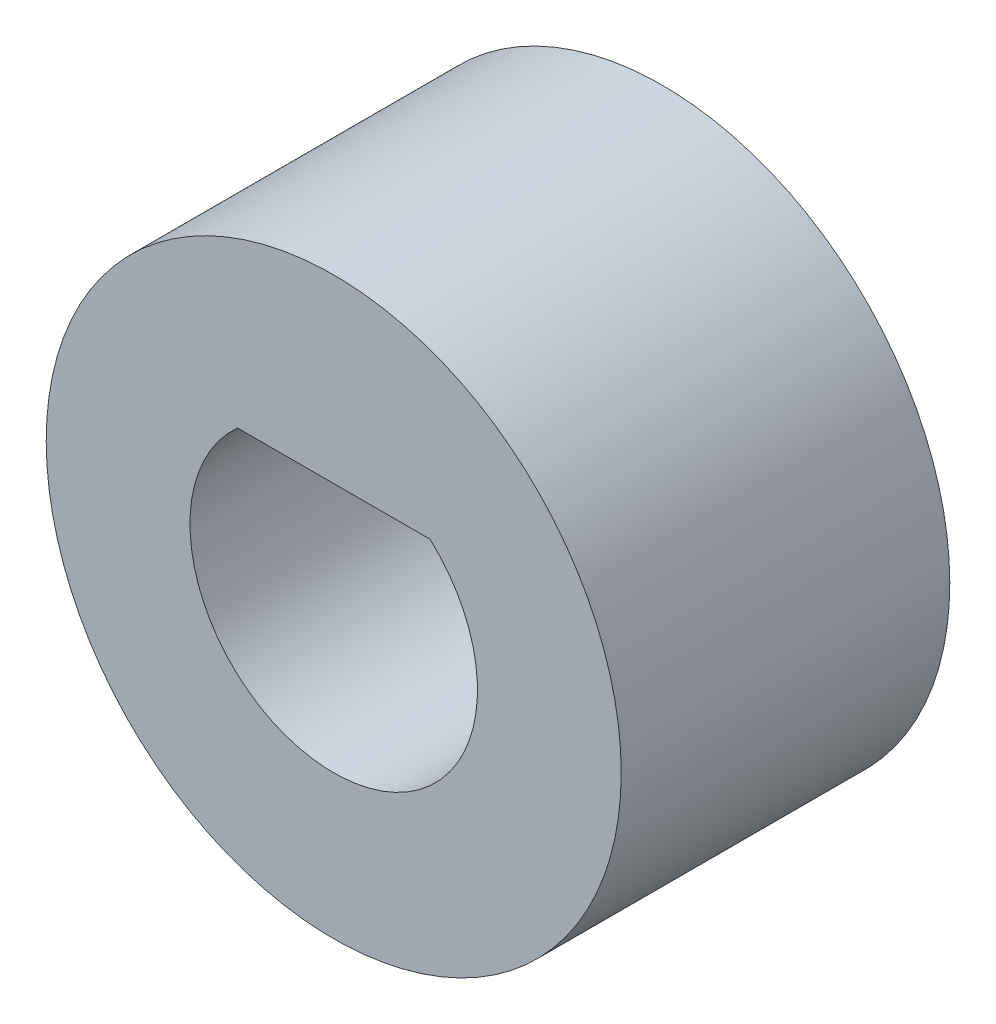
from build123d import *

# Parameters (mm, degrees)
ESQUISSE1_R        = 7
BOSS_EXTRU_1_DEPTH = 8


with BuildPart() as part:
    # Esquisse1 → Boss.-Extru.1 (new body)
    with BuildSketch(Plane.XY):
        Circle(ESQUISSE1_R)
        with BuildLine():
            Line((-2.343074903, 2.6), (2.343074903, 2.6))
            ThreePointArc((2.343074903, 2.6), (0, -3.5), (-2.343074903, 2.6))
        make_face(mode=Mode.SUBTRACT)
    extrude(amount=BOSS_EXTRU_1_DEPTH)


solid = part.part
